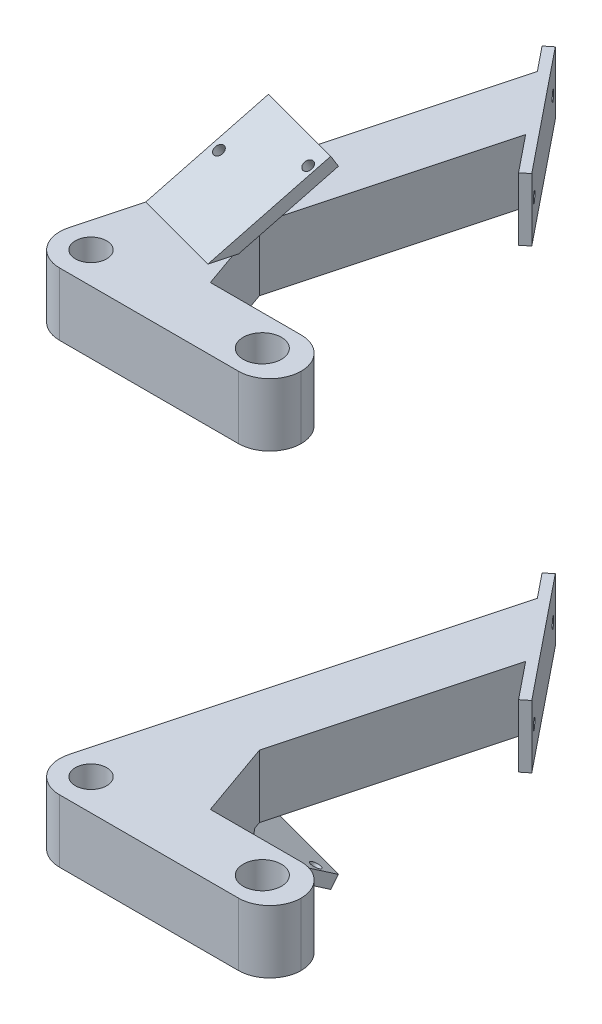
from build123d import *

# Parameters (mm, degrees)
SKETCH_1_W               = 100
SKETCH_1_H               = 20
EXTRUDE_1_DEPTH          = 20
SKETCH_2_R               = 6.1
CUT_EXTRUDE_1_DEPTH      = 58.445626465
FILLET_1_R               = 10
FILLET_2_R               = 10
SKETCH_4_W               = 20
SKETCH_4_H               = 20
CUT_EXTRUDE_2_DEPTH      = 20
EXTRUDE_2_DEPTH          = 20
CUT_EXTRUDE_3_DEPTH      = 130.258709652
CUT_EXTRUDE_4_DEPTH      = 130.258709652
EXTRUDE_3_DEPTH          = 20
EXTRUDE_4_DEPTH          = 20
FILLET_3_R               = 10
EXTRUDE_5_DEPTH          = 20
EXTRUDE_6_DEPTH          = 8
EXTRUDE_7_REACH          = 140.193
CUT_EXTRUDE_5_DEPTH      = 210.16834973
CUT_EXTRUDE_5_DEPTH_BACK = 210.16834973
SKETCH_15_R              = 5
CUT_EXTRUDE_6_DEPTH      = 242.818562796
CUT_EXTRUDE_6_DEPTH_BACK = 10
SKETCH_16_R              = 1.6
SKETCH_18_R              = 1.6
CUT_EXTRUDE_7_DEPTH      = 10
SKETCH_19_R              = 1.6
CUT_EXTRUDE_8_DEPTH      = 10
SKETCH_20_R              = 1.6
CUT_EXTRUDE_9_DEPTH      = 10


with BuildPart() as part:
    # 草图1 → 凸台-拉伸1 (new body)
    with BuildSketch(Plane.XY):
        Rectangle(SKETCH_1_W, SKETCH_1_H)
    extrude(amount=EXTRUDE_1_DEPTH)

    # 草图2 → 切除-拉伸1 (cut, through all)
    with BuildSketch(Plane(origin=(0, 10, 0), x_dir=(1, 0, 0), z_dir=(0, 1, 0))):
        with Locations(Location((37.5, -9.880544607, 0), (0, 0, 270))):
            Circle(SKETCH_2_R)
    extrude(amount=-CUT_EXTRUDE_1_DEPTH, mode=Mode.SUBTRACT)

    # 圆角1
    fillet_1_edges = [part.edges().sort_by_distance(p)[0] for p in [
        (50, 0, 20),
    ]]
    fillet(fillet_1_edges, radius=FILLET_1_R)

    # 圆角2
    fillet_2_edges = [part.edges().sort_by_distance(p)[0] for p in [
        (50, 0, 0),
    ]]
    fillet(fillet_2_edges, radius=FILLET_2_R - 0.0001)  # a hair under: the kernel refuses the full size

    # 草图4 → 切除-拉伸2 (cut)
    with BuildSketch(Plane.ZY.offset(50)):
        with Locations((10, 0)):
            Rectangle(SKETCH_4_W, SKETCH_4_H)
    extrude(amount=-CUT_EXTRUDE_2_DEPTH, mode=Mode.SUBTRACT)

    # 草图6 → 凸台-拉伸2 (add)
    with BuildSketch(Plane(origin=(0, 10, 0), x_dir=(1, 0, 0), z_dir=(0, 1, 0))):
        Polygon((-3.935492543, 0), (22.386428262, 98.234745796), (6.84479722, 117.50665522), (-30, -20), align=None)
    extrude(amount=-EXTRUDE_2_DEPTH)

    # 草图7 → 切除-拉伸3 (cut, through all)
    with BuildSketch(Plane(origin=(0, 10, 0), x_dir=(1, 0, 0), z_dir=(0, 1, 0))):
        Polygon((-24.641016151, 0), (-30, -20), (-30, 0), align=None)
    extrude(amount=-CUT_EXTRUDE_3_DEPTH, mode=Mode.SUBTRACT)

    # 草图9 → 切除-拉伸4 (cut, through all)
    with BuildSketch(Plane(origin=(0, 10, 0), x_dir=(1, 0, 0), z_dir=(0, 1, 0))):
        Polygon((6.84479722, 117.50665522), (22.386428262, 98.234745796), (21.425259639, 94.64761566), (5.883628597, 113.919525084), align=None)
    extrude(amount=-CUT_EXTRUDE_4_DEPTH, mode=Mode.SUBTRACT)

    # 草图10 → 凸台-拉伸3 (add, through all)
    with BuildSketch(Plane(origin=(0, 10, 0), x_dir=(1, 0, 0), z_dir=(0, 1, 0))):
        Polygon((11.064507457, 0), (-3.935492543, 0), (2.534983584, 24.148145657), align=None)
    extrude(amount=-EXTRUDE_3_DEPTH)

    # 草图11 → 凸台-拉伸4 (add, through all)
    with BuildSketch(Plane(origin=(0, 10, 0), x_dir=(1, 0, 0), z_dir=(0, 1, 0))):
        Polygon((0.980244914, 119.999811377), (32.215545654, 81.267461789), (29.880292834, 79.384221425), (-1.355007905, 118.116571014), align=None)
    extrude(amount=-EXTRUDE_4_DEPTH)

    # 圆角3
    fillet_3_edges = [part.edges().sort_by_distance(p)[0] for p in [
        (-30, 0, 20),
    ]]
    fillet(fillet_3_edges, radius=FILLET_3_R)

    # 草图12 → 凸台-拉伸5 (add)
    with BuildSketch(Plane(origin=(-22.990381057, 0, -6.160254038), x_dir=(-0.2588190451025246, 0, 0.9659258262890673), z_dir=(-0.9659258262890673, 0, -0.2588190451025246))):
        Polygon((-5.94916585, 10), (-13.94916585, 10), (-39.929927963, 25), (-37.929927963, 28.464101615), align=None)
    extrude(amount=-EXTRUDE_5_DEPTH)

    # 草图13 → 凸台-拉伸6 (add)
    with BuildSketch(Plane(origin=(-3.671864531, 0, -0.983873136), x_dir=(0.2588190451025246, 0, -0.9659258262890672), z_dir=(0.9659258262890673, 0, 0.2588190451025247))):
        Polygon((37.929927963, 28.464101615), (5.94916585, 10), (13.94916585, 10), (39.929927963, 25), align=None)
    extrude(amount=EXTRUDE_6_DEPTH)

    # 凸台-拉伸7: up to this plane
    extrude_7_end = Plane(origin=(2.534983584, -10, -24.148145657), z_dir=(0.9429088246168765, 0, -0.33305096976231796))
    # 草图14 → 凸台-拉伸7 (add, up to the surface)
    with BuildSketch(Plane(origin=(-22.990381057, 0, -6.160254038), x_dir=(-0.2588190451025246, 0, 0.9659258262890673), z_dir=(-0.9659258262890673, 0, -0.2588190451025246)), mode=Mode.PRIVATE) as extrude_7_sk1:
        Polygon((-20.87736908, 14), (-13.94916585, 10), (-21.94916585, 10), align=None)
    extrude_7_tool1 = split(extrude(extrude_7_sk1.sketch, amount=-EXTRUDE_7_REACH, mode=Mode.PRIVATE), bisect_by=extrude_7_end, keep=Keep.BOTH, mode=Mode.PRIVATE)
    add(extrude_7_tool1.solids().sort_by_distance((-18.09217, 11.333333, -24.440626))[0])


with BuildPart() as body_2:
    # 镜向1: mirrored copy
    add(part.part.mirror(Plane(origin=(0, -72.7, 0), x_dir=(0, 0, 1), z_dir=(0, -1, 0))))


with BuildPart() as cut_extrude_5_tool:
    # 草图15 → 切除-拉伸5 (new, two sides: drawn at the far end of the back side and taken through both)
    with BuildSketch(Plane.XZ.offset(10).offset(-CUT_EXTRUDE_5_DEPTH_BACK)):
        with Locations(Location((-16.967746272, 10, 0), (0, 0, 270))):
            Circle(SKETCH_15_R)
    extrude(amount=CUT_EXTRUDE_5_DEPTH + CUT_EXTRUDE_5_DEPTH_BACK)


with BuildPart() as part_1:
    add(part.part)

    # 切除-拉伸5: cut by cut_extrude_5_tool
    add(cut_extrude_5_tool.part, mode=Mode.SUBTRACT)

    # 草图18 → 切除-拉伸7 (cut)
    with BuildSketch(Plane(origin=(-0.735779984, 4.923935621, 2.745968284), x_dir=(0.9915912340642462, 0.11302231218972869, 0.06303000455523398), z_dir=(-0.12940952255126095, 0.8660254037844418, 0.4829629131445286))):
        with Locations(Location((-13.447263702, 34.073742899, 0), (0, 0, 270))):
            Circle(SKETCH_18_R)
        with Locations(Location((11.127233063, 40.496679047, 0), (0, 0, 270))):
            Circle(SKETCH_18_R)
    extrude(amount=-CUT_EXTRUDE_7_DEPTH, mode=Mode.SUBTRACT)

    # 草图19 → 切除-拉伸8 (cut)
    with BuildSketch(Plane(origin=(56.896516967, 0, -45.883604723), x_dir=(0.6277467879246018, 0, 0.7784176065906688), z_dir=(-0.7784176065906688, 0, 0.6277467879246018))):
        with Locations((-87.794620367, 0)):
            Circle(SKETCH_19_R)
        with Locations((-48.036817794, 0)):
            Circle(SKETCH_19_R)
    extrude(amount=-CUT_EXTRUDE_8_DEPTH, mode=Mode.SUBTRACT)


with BuildPart() as body_2_1:
    add(body_2.part)

    # 切除-拉伸5: cut by cut_extrude_5_tool
    add(cut_extrude_5_tool.part, mode=Mode.SUBTRACT)

    # 草图16 → 切除-拉伸6 (cut, two sides: drawn at the far end of the back side and taken through both)
    with BuildSketch(Plane(origin=(-17.031039191, -113.973935621, 63.560703566), x_dir=(0.9915912340642462, -0.11302231218972869, 0.06303000455523398), z_dir=(-0.12940952255126095, -0.8660254037844418, 0.4829629131445286)).offset(-CUT_EXTRUDE_6_DEPTH_BACK)):
        with Locations(Location((2.986180491, -104.892044997, 0), (0, 0, 90))):
            Circle(SKETCH_16_R)
        with Locations(Location((27.560677255, -111.314981145, 0), (0, 0, 90))):
            Circle(SKETCH_16_R)
    extrude(amount=CUT_EXTRUDE_6_DEPTH + CUT_EXTRUDE_6_DEPTH_BACK, mode=Mode.SUBTRACT)

    # 草图20 → 切除-拉伸9 (cut)
    with BuildSketch(Plane(origin=(56.896516967, 0, -45.883604723), x_dir=(0.6277467879246018, 0, 0.7784176065906688), z_dir=(-0.7784176065906688, 0, 0.6277467879246018))):
        with Locations((-87.794620367, -145.4)):
            Circle(SKETCH_20_R)
        with Locations((-48.036817794, -145.4)):
            Circle(SKETCH_20_R)
    extrude(amount=-CUT_EXTRUDE_9_DEPTH, mode=Mode.SUBTRACT)


solid = Compound([part_1.part, body_2_1.part])
